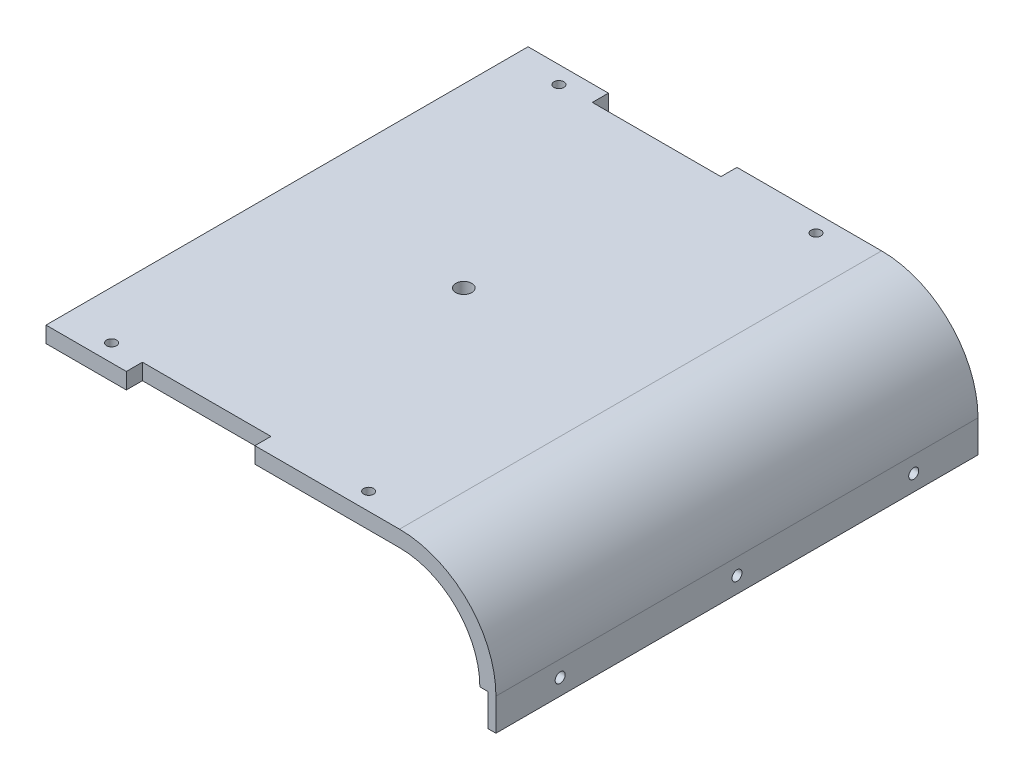
from build123d import *

# Parameters (mm, degrees)
BOSS_EXTRUDE1_DEPTH      = 190.5
BOSS_EXTRUDE1_DEPTH_BACK = 190.5
SKETCH2_W                = 6.35
SKETCH2_H                = 381
BOSS_EXTRUDE2_DEPTH      = 25.4
SKETCH3_R                = 3.96875
CUT_EXTRUDE1_DEPTH       = 25.4
SKETCH4_R                = 6.35
CUT_EXTRUDE2_DEPTH       = 17.78
SKETCH5_R                = 3.937
CUT_EXTRUDE3_DEPTH       = 306.328708116


with BuildPart() as part:
    # Sketch1 → Boss-Extrude1 (new, two sides: drawn at the far end of the back side and taken through both)
    with BuildSketch(Plane.XY.offset(-BOSS_EXTRUDE1_DEPTH_BACK)):
        with BuildLine():
            Line((-139.7, 0), (139.7, 0))
            ThreePointArc((139.7, 0), (193.581536726, -22.318463274), (215.9, -76.2))
            Line((215.9, -76.2), (203.2, -76.2))
            ThreePointArc((203.2, -76.2), (184.601280605, -31.298719395), (139.7, -12.7))
            Line((139.7, -12.7), (-139.7, -12.7))
            Line((-139.7, -12.7), (-139.7, 0))
        make_face()
    extrude(amount=BOSS_EXTRUDE1_DEPTH + BOSS_EXTRUDE1_DEPTH_BACK)

    # Sketch2 → Boss-Extrude2 (add)
    with BuildSketch(Plane.XZ.offset(76.2)):
        with Locations((212.725, 0)):
            Rectangle(SKETCH2_W, SKETCH2_H)
    extrude(amount=BOSS_EXTRUDE2_DEPTH)

    # Sketch3 → Cut-Extrude1 (cut)
    with BuildSketch(Plane(origin=(215.9, 0, 0), x_dir=(0, 0, -1), z_dir=(1, 0, 0))):
        with Locations((-139.7, -88.9)):
            Circle(SKETCH3_R)
        with Locations((0, -88.9)):
            Circle(SKETCH3_R)
        with Locations((139.7, -88.9)):
            Circle(SKETCH3_R)
    extrude(amount=-CUT_EXTRUDE1_DEPTH, mode=Mode.SUBTRACT)

    # Sketch4 → Cut-Extrude2 (cut)
    with BuildSketch(Plane(origin=(0, 0, 0), x_dir=(1, 0, 0), z_dir=(0, 1, 0))):
        Circle(SKETCH4_R)
    extrude(amount=-CUT_EXTRUDE2_DEPTH, mode=Mode.SUBTRACT)

    # Sketch5 → Cut-Extrude3 (cut, through all)
    with BuildSketch(Plane(origin=(0, 0, 0), x_dir=(1, 0, 0), z_dir=(0, 1, 0))):
        with Locations((-101.6, -176.784)):
            Circle(SKETCH5_R)
        with Locations((101.6, -176.784)):
            Circle(SKETCH5_R)
        with Locations((101.6, 176.784)):
            Circle(SKETCH5_R)
        with Locations((-101.6, 176.784)):
            Circle(SKETCH5_R)
        Polygon((0, -190.5), (-76.2, -190.5), (-76.2, -177.8), (0, -177.8), (25.4, -177.8), (25.4, -190.5), align=None)
        Polygon((25.4, 177.8), (25.4, 190.5), (0, 190.5), (-76.2, 190.5), (-76.2, 177.8), (0, 177.8), align=None)
    extrude(amount=-CUT_EXTRUDE3_DEPTH, mode=Mode.SUBTRACT)


solid = part.part
